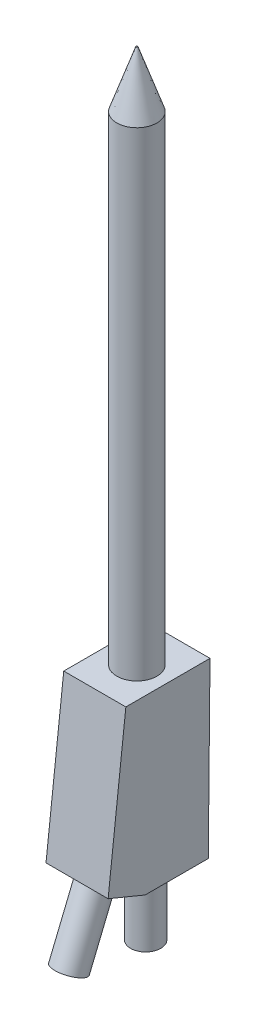
from build123d import *

# Parameters (mm, degrees)
SKETCH1_R           = 2
BOSS_EXTRUDE1_DEPTH = 50
BOSS_EXTRUDE2_DEPTH = 3.1
SKETCH4_R           = 1.5
BOSS_EXTRUDE3_DEPTH = 7
SKETCH5_R           = 1.5
BOSS_EXTRUDE4_DEPTH = 7


with BuildPart() as part:
    # Sketch1 → Boss-Extrude1 (new body)
    with BuildSketch(Plane(origin=(0, 0, 0), x_dir=(1, 0, 0), z_dir=(0, 1, 0))):
        Circle(SKETCH1_R)
    extrude(amount=BOSS_EXTRUDE1_DEPTH)

    # Sketch2 → Revolve1 (revolve)
    with BuildSketch(Plane.XY):
        Polygon((0, 55.6), (0, 50), (2, 50), (0.078528032, 55.6), align=None)
    revolve(axis=Axis((0, 55.6, 0), (0, -1, 0)))

    # Sketch3 → Boss-Extrude2 (add, symmetric)
    with BuildSketch(Plane(origin=(0, 0, 0), x_dir=(0, 0, -1), z_dir=(1, 0, 0))):
        Polygon((-4.2, 2.171539087), (4.2, 2.171539087), (4.029893124, -15.048329328), (-2.270106876, -15.048329328), (-5.970106876, -13.528460913), align=None)
    extrude(amount=BOSS_EXTRUDE2_DEPTH, both=True)

    # Sketch4 → Boss-Extrude3 (add)
    with BuildSketch(Plane(origin=(0, -13.673600271, 5.616776534), x_dir=(-1, 0, 0), z_dir=(0, -0.9250000000000002, 0.37996710383926635))):
        with Locations((0, 1.618021252)):
            Circle(SKETCH4_R)
    extrude(amount=BOSS_EXTRUDE3_DEPTH)

    # Sketch5 → Boss-Extrude4 (add)
    with BuildSketch(Plane(origin=(0, -15.048329328, 0), x_dir=(-1, 0, 0), z_dir=(0, -1, 0))):
        with Locations((0, 0.879893124)):
            Circle(SKETCH5_R)
    extrude(amount=BOSS_EXTRUDE4_DEPTH)


solid = part.part
